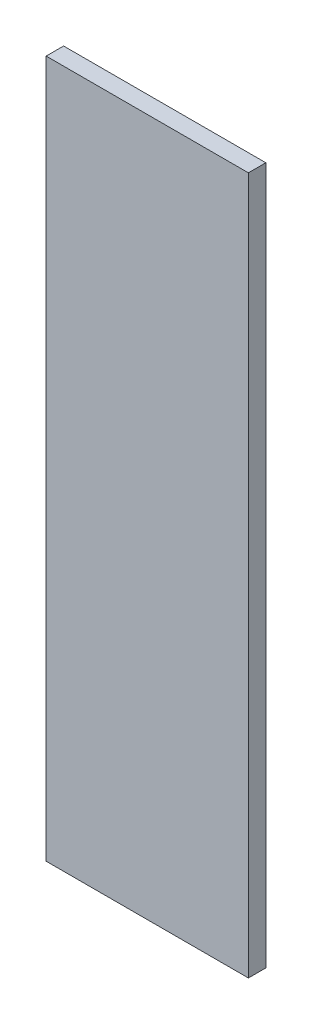
from build123d import *

# Parameters (mm, degrees)
ESQUISSE1_W               = 58
ESQUISSE1_H               = 200
T_LE_DE_BASE_PLI_E1_DEPTH = 5


# Sheet-metal steps are written as plain solids
with BuildPart() as part:
    # Esquisse1 → Tôle de base pliée1 (new body)
    with BuildSketch(Plane.XY):
        Rectangle(ESQUISSE1_W, ESQUISSE1_H)
    extrude(amount=-T_LE_DE_BASE_PLI_E1_DEPTH)


solid = part.part
